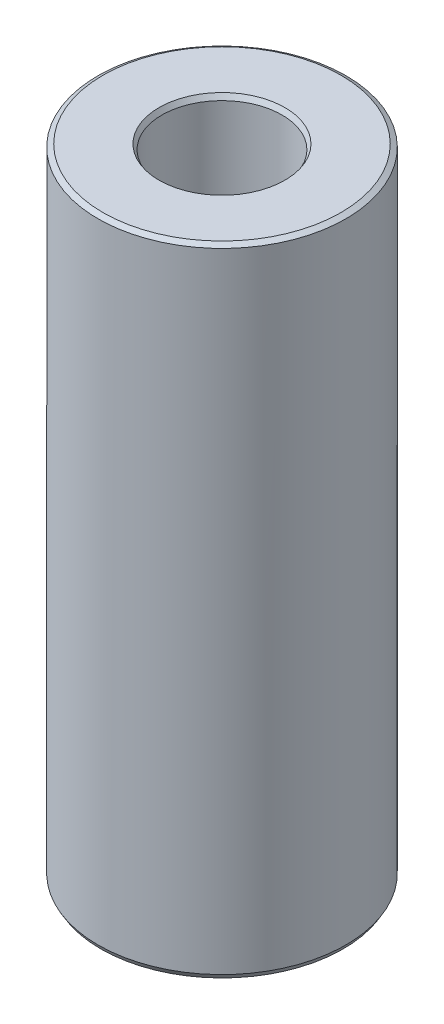
from build123d import *
from OCP.BRepFilletAPI import BRepFilletAPI_MakeChamfer

# Parameters (mm, degrees)
SKETCH1_R           = 45
BOSS_EXTRUDE1_DEPTH = 231.123114335
SKETCH2_R           = 21.808864303
CUT_EXTRUDE1_DEPTH  = 240.724621139
CHAMFER1_SIZE       = 1.043056948
CHAMFER1_SIZE2      = 1.806627629


with BuildPart() as part:
    # Sketch1 → Boss-Extrude1 (new body)
    with BuildSketch(Plane(origin=(0, 0, 0), x_dir=(1, 0, 0), z_dir=(0, 1, 0))):
        Circle(SKETCH1_R)
    extrude(amount=BOSS_EXTRUDE1_DEPTH)

    # Sketch2 → Cut-Extrude1 (cut, through all)
    with BuildSketch(Plane(origin=(0, 0, 0), x_dir=(1, 0, 0), z_dir=(0, 1, 0))):
        Circle(SKETCH2_R)
    extrude(amount=CUT_EXTRUDE1_DEPTH, mode=Mode.SUBTRACT)

    # Chamfer1: one chamfer whose edges measure the first distance from different faces: ONE call of the kernel's chamfer builder (chamfer() names one face for all edges)
    chamfer1_edges_1 = [part.edges().sort_by_distance(p)[0] for p in [
        (-21.808864303, 231.123114335, 0),
    ]]
    chamfer1_side_1 = [part.faces().sort_by_distance(p)[0] for p in [
        (-43.727207794, 231.123114335, 0),
    ]]
    chamfer1_edges_2 = [part.edges().sort_by_distance(p)[0] for p in [
        (-21.808864303, 0, 0),
    ]]
    chamfer1_side_2 = [part.faces().sort_by_distance(p)[0] for p in [
        (-21.808864303, 115.561557168, 0),
    ]]
    chamfer1_edges_3 = [part.edges().sort_by_distance(p)[0] for p in [
        (-45, 0, 0),
    ]]
    chamfer1_side_3 = [part.faces().sort_by_distance(p)[0] for p in [
        (-43.727207794, 0, 0),
    ]]
    chamfer1_edges_4 = [part.edges().sort_by_distance(p)[0] for p in [
        (-45, 231.123114335, 0),
    ]]
    chamfer1_side_4 = [part.faces().sort_by_distance(p)[0] for p in [
        (-45, 115.561557168, 0),
    ]]
    chamfer1 = BRepFilletAPI_MakeChamfer(part.part.solid().wrapped)
    for e in chamfer1_edges_1:
        chamfer1.Add(CHAMFER1_SIZE, CHAMFER1_SIZE2, e.wrapped, chamfer1_side_1[0].wrapped)  # the first distance lies on this face
    for e in chamfer1_edges_2:
        chamfer1.Add(CHAMFER1_SIZE, CHAMFER1_SIZE2, e.wrapped, chamfer1_side_2[0].wrapped)  # the first distance lies on this face
    for e in chamfer1_edges_3:
        chamfer1.Add(CHAMFER1_SIZE, CHAMFER1_SIZE2, e.wrapped, chamfer1_side_3[0].wrapped)  # the first distance lies on this face
    for e in chamfer1_edges_4:
        chamfer1.Add(CHAMFER1_SIZE, CHAMFER1_SIZE2, e.wrapped, chamfer1_side_4[0].wrapped)  # the first distance lies on this face
    add(Compound.cast(chamfer1.Shape()), mode=Mode.REPLACE)


solid = part.part
